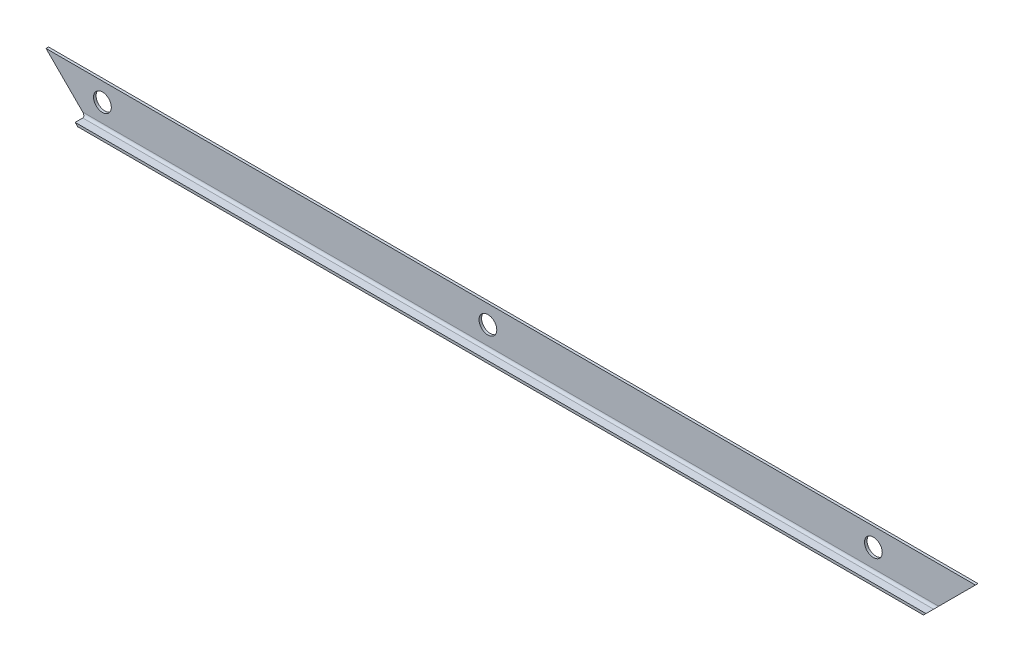
from build123d import *

# Parameters (mm, degrees)
SKETCH1_W                    = 1080
SKETCH1_H                    = 33
BASE_FLANGE1_DEPTH           = 2
EDGE_FLANGE1_STRIP_W         = 12
EDGE_FLANGE1_STRIP_H         = 2
EDGE_FLANGE1_STRIP_CUT_DEPTH = 1080
EDGE_FLANGE1_DEPTH           = 1080
SKETCH9_R                    = 7
CUT_EXTRUDE1_DEPTH           = 10
CUT_EXTRUDE2_DEPTH           = 40
CUT_EXTRUDE2_DEPTH_BACK      = 40


# Sheet-metal steps are written as plain solids
with BuildPart() as part:
    # Sketch1 → Base-Flange1 (new body)
    with BuildSketch(Plane.XY):
        Rectangle(SKETCH1_W, SKETCH1_H)
    extrude(amount=-BASE_FLANGE1_DEPTH)

    # Edge-Flange1 strip (across the edge) → Edge-Flange1 strip cut (cut)
    with BuildSketch(Plane(origin=(-540, -16.5, 0), x_dir=(0, 1, 0), z_dir=(1, 0, 0))):
        with Locations((-2, -1)):
            Rectangle(EDGE_FLANGE1_STRIP_W, EDGE_FLANGE1_STRIP_H)
    extrude(amount=EDGE_FLANGE1_STRIP_CUT_DEPTH, mode=Mode.SUBTRACT)

    # Edge-Flange1 section (across the edge) → Edge-Flange1 (add)
    with BuildSketch(Plane(origin=(-540, -16.5, 0), x_dir=(0, 1, 0), z_dir=(1, 0, 0))):
        with BuildLine():
            Line((0, 2), (0, 8))
            Line((0, 8), (2, 8))
            Line((2, 8), (2, 2))
            ThreePointArc((2, 2), (2.585786438, 0.585786438), (4, 0))
            Line((4, 0), (4, -2))
            ThreePointArc((4, -2), (1.171572875, -0.828427125), (0, 2))
        make_face()
    extrude(amount=EDGE_FLANGE1_DEPTH)

    # Sketch9 → Cut-Extrude1 (cut)
    with BuildSketch(Plane.XY):
        with Locations((-930, 2)):
            Circle(SKETCH9_R)
        with Locations((-626, 2)):
            Circle(SKETCH9_R)
        with Locations((-322, 2)):
            Circle(SKETCH9_R)
        with Locations((-18, 2)):
            Circle(SKETCH9_R)
        with Locations((286, 2)):
            Circle(SKETCH9_R)
        with Locations((590, 2)):
            Circle(SKETCH9_R)
        with Locations((894, 2)):
            Circle(SKETCH9_R)
    extrude(amount=-CUT_EXTRUDE1_DEPTH, mode=Mode.SUBTRACT)

    # Sketch10 → Cut-Extrude2 (cut, two sides: drawn at the far end of the back side and taken through both)
    with BuildSketch(Plane.XY.offset(-CUT_EXTRUDE2_DEPTH_BACK)):
        Polygon((-302.377446669, -47.622553331), (-401.622553331, 51.622553331), (-590.417878705, 51.622553331), (-583.65364731, -79.056750642), (-558.625991149, -79.056750642), align=None)
        Polygon((558.625991149, -79.056750642), (302.377446669, -47.622553331), (401.622553331, 51.622553331), (590.417878705, 51.622553331), (583.65364731, -79.056750642), align=None)
    extrude(amount=CUT_EXTRUDE2_DEPTH + CUT_EXTRUDE2_DEPTH_BACK, mode=Mode.SUBTRACT)


solid = part.part
